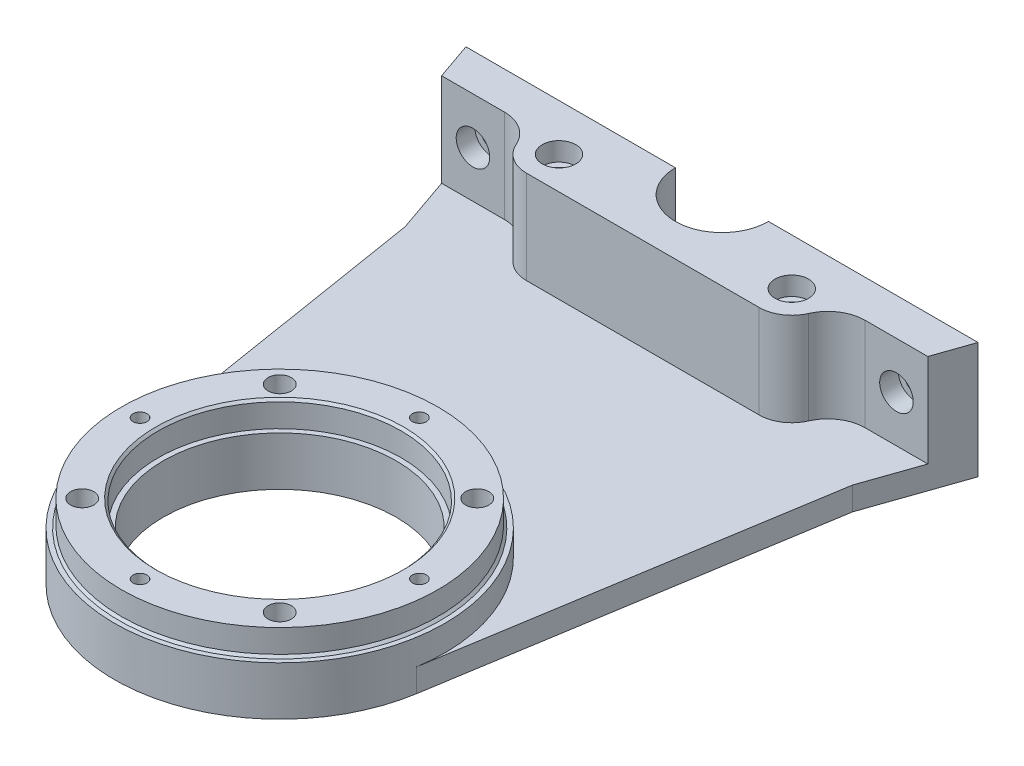
from build123d import *

# Parameters (mm, degrees)
SKETCH1_R           = 34
SKETCH1_R_2         = 26.1
BOSS_EXTRUDE1_DEPTH = 5.5
SKETCH2_R           = 35.5
SKETCH2_R_2         = 25
BOSS_EXTRUDE2_DEPTH = 5.5
SKETCH3_R           = 25
SKETCH3_R_2         = 2.2
BOSS_EXTRUDE3_DEPTH = 5
CHAMFER1_SIZE       = 0.5
SKETCH5_R           = 2.5
SKETCH5_R_2         = 1.5
CUT_EXTRUDE1_DEPTH  = 111.932411855
BOSS_EXTRUDE4_START = 20
SKETCH6_R           = 2.2
BOSS_EXTRUDE4_DEPTH = 20
SKETCH7_R           = 3.6
CUT_EXTRUDE2_DEPTH  = 4
SKETCH8_R           = 2.2
CUT_EXTRUDE3_DEPTH  = 8
SKETCH9_R           = 3.6
CUT_EXTRUDE4_DEPTH  = 4


with BuildPart() as part:
    # Sketch1 → Boss-Extrude1 (new body)
    with BuildSketch(Plane(origin=(0, 0, 0), x_dir=(1, 0, 0), z_dir=(0, 1, 0))):
        Circle(SKETCH1_R)
        Circle(SKETCH1_R_2, mode=Mode.SUBTRACT)
    extrude(amount=BOSS_EXTRUDE1_DEPTH)

    # Sketch2 → Boss-Extrude2 (add)
    with BuildSketch(Plane(origin=(0, 0, 0), x_dir=(-1, 0, 0), z_dir=(0, -1, 0))):
        Circle(SKETCH2_R)
        Circle(SKETCH2_R_2, mode=Mode.SUBTRACT)
    extrude(amount=BOSS_EXTRUDE2_DEPTH)

    # Sketch3 → Boss-Extrude3 (add)
    with BuildSketch(Plane.XZ.offset(5.5)):
        with BuildLine():
            Line((-55, -95), (-10, -95))
            ThreePointArc((-10, -95), (0, -85), (10, -95))
            Line((10, -95), (55, -95))
            Line((55, -95), (48.055, -75))
            Line((48.055, -75), (35.047098592, 5.652510971))
            ThreePointArc((35.047098592, 5.652510971), (0, 35.5), (-35.047098592, 5.652510971))
            Line((-35.047098592, 5.652510971), (-48.055, -75))
            Line((-48.055, -75), (-55, -95))
        make_face()
        Circle(SKETCH3_R, mode=Mode.SUBTRACT)
        with Locations((-25, -85)):
            Circle(SKETCH3_R_2, mode=Mode.SUBTRACT)
        with Locations((25, -85)):
            Circle(SKETCH3_R_2, mode=Mode.SUBTRACT)
    extrude(amount=BOSS_EXTRUDE3_DEPTH)

    # Chamfer1
    chamfer1_edges = [part.edges().sort_by_distance(p)[0] for p in [
        (-34, 0, 0),
        (-26.1, 5.5, 0),
    ]]
    chamfer(chamfer1_edges, length=CHAMFER1_SIZE)

    # Sketch5 → Cut-Extrude1 (cut, through all)
    with BuildSketch(Plane(origin=(0, 5.5, 0), x_dir=(1, 0, 0), z_dir=(0, 1, 0))):
        with Locations((21.213203436, 21.213203436)):
            Circle(SKETCH5_R)
        with Locations((0, 30)):
            Circle(SKETCH5_R_2)
        with Locations((30, 0)):
            Circle(SKETCH5_R_2)
        with Locations((0, -30)):
            Circle(SKETCH5_R_2)
        with Locations((-30, 0)):
            Circle(SKETCH5_R_2)
        with Locations((21.213203436, -21.213203436)):
            Circle(SKETCH5_R)
        with Locations((-21.213203436, -21.213203436)):
            Circle(SKETCH5_R)
        with Locations((-21.213203436, 21.213203436)):
            Circle(SKETCH5_R)
    extrude(amount=-CUT_EXTRUDE1_DEPTH, mode=Mode.SUBTRACT)

    # Sketch6 → Boss-Extrude4 (add)
    with BuildSketch(Plane(origin=(0, -5.5, 0), x_dir=(1, 0, 0), z_dir=(0, 1, 0)).offset(BOSS_EXTRUDE4_START)):
        with BuildLine():
            Line((52.222, 87), (55, 95))
            Line((55, 95), (10, 95))
            ThreePointArc((10, 95), (0, 85), (-10, 95))
            Line((-10, 95), (-55, 95))
            Line((-55, 95), (-52.222, 87))
            Line((-52.222, 87), (-38.747727085, 87))
            ThreePointArc((-38.747727085, 87), (-34.365946625, 85.693280212), (-31.415605973, 82.2))
            ThreePointArc((-31.415605973, 82.2), (-28.834057903, 79.143379814), (-25, 78))
            Line((-25, 78), (25, 78))
            ThreePointArc((25, 78), (28.834057903, 79.143379814), (31.415605973, 82.2))
            ThreePointArc((31.415605973, 82.2), (34.365946625, 85.693280212), (38.747727085, 87))
            Line((38.747727085, 87), (52.222, 87))
        make_face()
        with Locations((-25, 85)):
            Circle(SKETCH6_R, mode=Mode.SUBTRACT)
        with Locations((25, 85)):
            Circle(SKETCH6_R, mode=Mode.SUBTRACT)
    extrude(amount=-BOSS_EXTRUDE4_DEPTH)

    # Sketch7 → Cut-Extrude2 (cut)
    with BuildSketch(Plane(origin=(0, 14.5, 0), x_dir=(1, 0, 0), z_dir=(0, 1, 0))):
        with Locations((25, 85)):
            Circle(SKETCH7_R)
        with Locations((-25, 85)):
            Circle(SKETCH7_R)
    extrude(amount=-CUT_EXTRUDE2_DEPTH, mode=Mode.SUBTRACT)

    # Sketch8 → Cut-Extrude3 (cut)
    with BuildSketch(Plane.XY.offset(-87)):
        with Locations((-45.484863542, 4.5)):
            Circle(SKETCH8_R)
        with Locations((45.484863542, 4.5)):
            Circle(SKETCH8_R)
    extrude(amount=-CUT_EXTRUDE3_DEPTH, mode=Mode.SUBTRACT)

    # Sketch9 → Cut-Extrude4 (cut)
    with BuildSketch(Plane.XY.offset(-87)):
        with Locations((-45.484863542, 4.5)):
            Circle(SKETCH9_R)
        with Locations((45.484863542, 4.5)):
            Circle(SKETCH9_R)
    extrude(amount=-CUT_EXTRUDE4_DEPTH, mode=Mode.SUBTRACT)


solid = part.part
